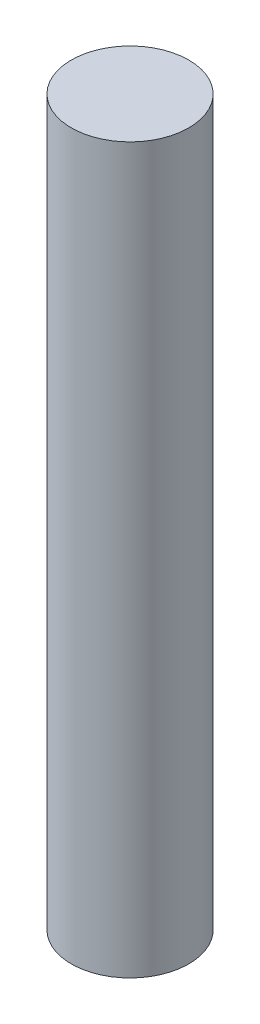
from build123d import *

# Parameters (mm, degrees)
CROQUIS1_R              = 4.7625
SALIENTE_EXTRUIR1_DEPTH = 58.68


with BuildPart() as part:
    # Croquis1 → Saliente-Extruir1 (new body)
    with BuildSketch(Plane(origin=(0, 0, 0), x_dir=(1, 0, 0), z_dir=(0, 1, 0))):
        Circle(CROQUIS1_R)
    extrude(amount=SALIENTE_EXTRUIR1_DEPTH)


solid = part.part
